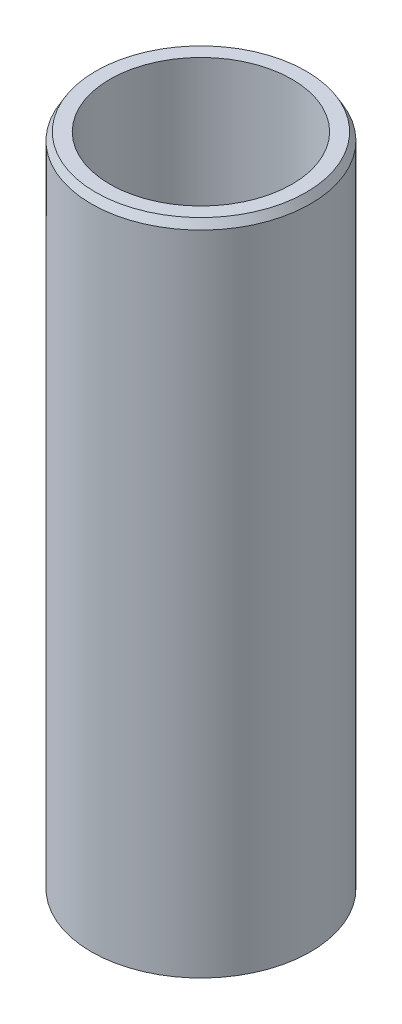
from build123d import *
from OCP.BRepFilletAPI import BRepFilletAPI_MakeChamfer

# Parameters (mm, degrees)
SKETCH1_R           = 57.5
BOSS_EXTRUDE1_DEPTH = 346.202775524
SKETCH2_R           = 47.749708002
CUT_EXTRUDE1_DEPTH  = 356.624607952
CHAMFER1_SIZE       = 4.049708111
CHAMFER1_SIZE2      = 2.338100068


with BuildPart() as part:
    # Sketch1 → Boss-Extrude1 (new body)
    with BuildSketch(Plane(origin=(0, 0, 0), x_dir=(1, 0, 0), z_dir=(0, 1, 0))):
        Circle(SKETCH1_R)
    extrude(amount=BOSS_EXTRUDE1_DEPTH)

    # Sketch2 → Cut-Extrude1 (cut, through all)
    with BuildSketch(Plane(origin=(0, 0, 0), x_dir=(1, 0, 0), z_dir=(0, 1, 0))):
        Circle(SKETCH2_R)
    extrude(amount=CUT_EXTRUDE1_DEPTH, mode=Mode.SUBTRACT)

    # Chamfer1: one chamfer whose edges measure the first distance from different faces: ONE call of the kernel's chamfer builder (chamfer() names one face for all edges)
    chamfer1_edges_1 = [part.edges().sort_by_distance(p)[0] for p in [
        (-57.5, 346.202775524, 0),
    ]]
    chamfer1_side_1 = [part.faces().sort_by_distance(p)[0] for p in [
        (-57.5, 173.101387762, 0),
    ]]
    chamfer1_edges_2 = [part.edges().sort_by_distance(p)[0] for p in [
        (-57.5, 0, 0),
    ]]
    chamfer1_side_2 = [part.faces().sort_by_distance(p)[0] for p in [
        (-55.873654403, 0, 0),
    ]]
    chamfer1 = BRepFilletAPI_MakeChamfer(part.part.solid().wrapped)
    for e in chamfer1_edges_1:
        chamfer1.Add(CHAMFER1_SIZE, CHAMFER1_SIZE2, e.wrapped, chamfer1_side_1[0].wrapped)  # the first distance lies on this face
    for e in chamfer1_edges_2:
        chamfer1.Add(CHAMFER1_SIZE, CHAMFER1_SIZE2, e.wrapped, chamfer1_side_2[0].wrapped)  # the first distance lies on this face
    add(Compound.cast(chamfer1.Shape()), mode=Mode.REPLACE)


solid = part.part
